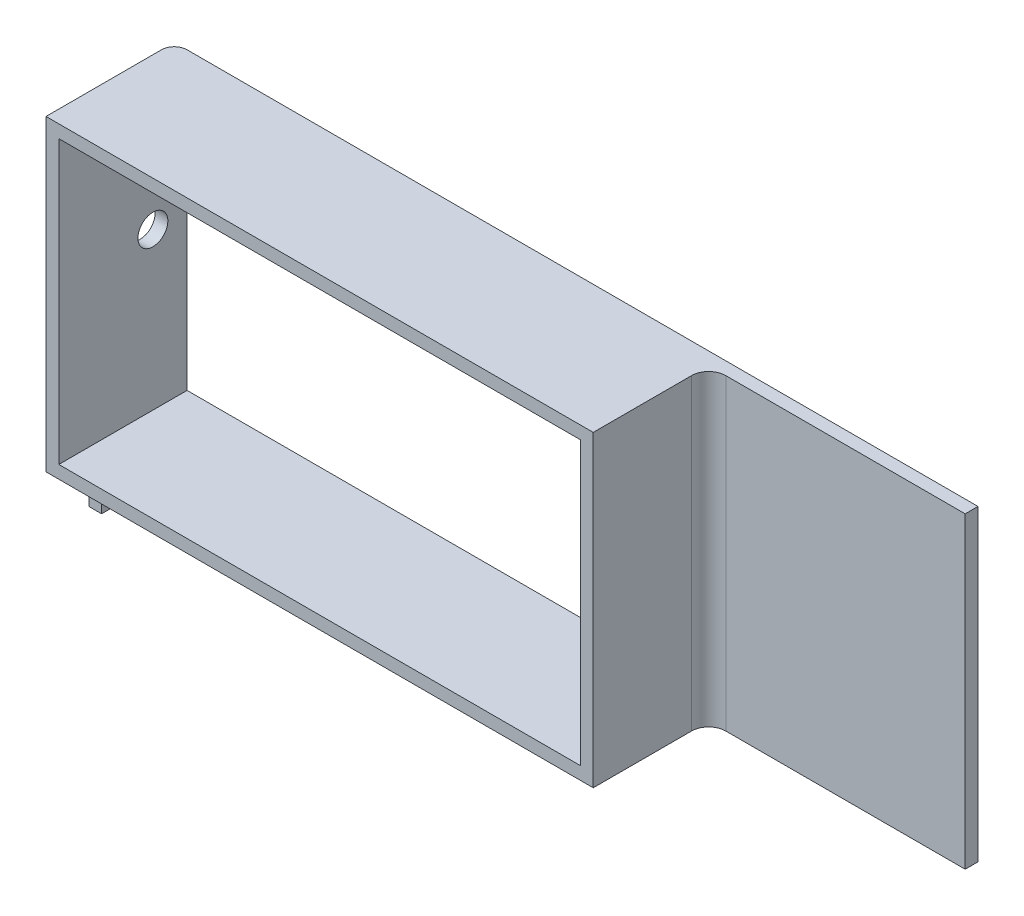
from build123d import *

# Parameters (mm, degrees)
LOFT_THIN1_OUTLINE_W      = 64
LOFT_THIN1_OUTLINE_H      = 36
LOFT_THIN1_OUTLINE_W_2    = 61
LOFT_THIN1_OUTLINE_H_2    = 33
LOFT_THIN1_DEPTH          = 5
SKETCH3_4_W               = 64
SKETCH3_4_H               = 36
SKETCH3_4_W_2             = 61
SKETCH3_4_H_2             = 33
EXTRUDE_THIN1_DEPTH       = 10
SKETCH8_W                 = 1.5
SKETCH8_H                 = 10
BOSS_EXTRUDE3_DEPTH       = 6
SKETCH7_W                 = 1.5
SKETCH7_H                 = 36
BOSS_EXTRUDE2_DEPTH       = 30
F_3_0MM_DOWEL_HOLE1_D     = 3.5
F_3_0MM_DOWEL_HOLE1_DEPTH = 7
F_3_0MM_DOWEL_HOLE1_TIP   = 1.051506083
FILLET1_R                 = 2
FILLET2_START             = -25
FILLET2_DEPTH             = 44


with BuildPart() as part:
    # Loft-Thin1: read off the stored shape, not the designer's step
    # Loft-Thin1 outline → Loft-Thin1 (new body)
    with BuildSketch(Plane.XY):
        Rectangle(LOFT_THIN1_OUTLINE_W, LOFT_THIN1_OUTLINE_H)
        Rectangle(LOFT_THIN1_OUTLINE_W_2, LOFT_THIN1_OUTLINE_H_2, mode=Mode.SUBTRACT)
    extrude(amount=LOFT_THIN1_DEPTH)

    # Sketch3<4> → Extrude-Thin1 (add)
    with BuildSketch(Plane.XY.offset(5)):
        Rectangle(SKETCH3_4_W, SKETCH3_4_H)
        Rectangle(SKETCH3_4_W_2, SKETCH3_4_H_2, mode=Mode.SUBTRACT)
    extrude(amount=EXTRUDE_THIN1_DEPTH)

    # Sketch8 → Boss-Extrude3 (add)
    with BuildSketch(Plane.XZ.offset(18)):
        with Locations((-31.25, 5)):
            Rectangle(SKETCH8_W, SKETCH8_H)
    extrude(amount=BOSS_EXTRUDE3_DEPTH)

    # Sketch7 → Boss-Extrude2 (add)
    with BuildSketch(Plane(origin=(32, 0, 0), x_dir=(0, 0, -1), z_dir=(1, 0, 0))):
        with Locations((-0.75, 0)):
            Rectangle(SKETCH7_W, SKETCH7_H)
    extrude(amount=BOSS_EXTRUDE2_DEPTH)

    # Ø3.0mm Dowel Hole1
    with Locations(Plane.ZY.offset(32)):
        with Locations((4, 1.8), (4, -18.5)):
            Hole(F_3_0MM_DOWEL_HOLE1_D / 2, depth=F_3_0MM_DOWEL_HOLE1_DEPTH)
            with Locations((0, 0, -(F_3_0MM_DOWEL_HOLE1_DEPTH + F_3_0MM_DOWEL_HOLE1_TIP / 2))):  # 118° drill point
                Cone(0, F_3_0MM_DOWEL_HOLE1_D / 2, F_3_0MM_DOWEL_HOLE1_TIP, mode=Mode.SUBTRACT)

    # Fillet1
    fillet1_edges = [part.edges().sort_by_distance(p)[0] for p in [
        (32, 0, 1.5),
    ]]
    fillet(fillet1_edges, radius=FILLET1_R)

    # Fillet2: read off the stored shape, not the designer's step
    # Fillet2 outline → Fillet2 (cut)
    with BuildSketch(Plane(origin=(0, 0, 0), x_dir=(1, 0, 0), z_dir=(0, 1, 0)).offset(FILLET2_START)):
        with BuildLine():
            Line((-32, 0), (-32, -1.5))
            ThreePointArc((-32, -1.5), (-31.560660172, -0.439339828), (-30.5, 0))
            Line((-30.5, 0), (-32, 0))
        make_face()
    extrude(amount=FILLET2_DEPTH, mode=Mode.SUBTRACT)


solid = part.part
